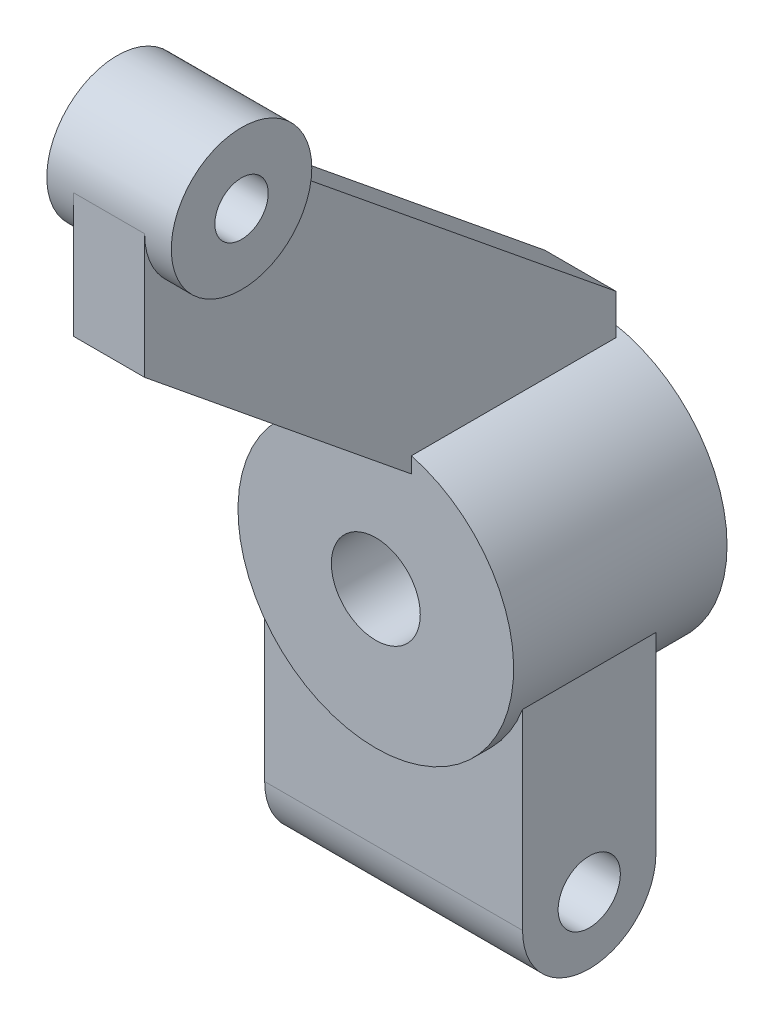
from build123d import *
from build123d.topology import SkipClean

# Parameters (mm, degrees)
SKETCH1_R            = 7.75
MAIN_CYLINDER_DEPTH  = 12
DROP_DEPTH           = 7.25
RISER_DEPTH          = 2
SKETCH5_R            = 3.95
RISER_BOSS_DEPTH     = 3.5
TOP_HOLES_DEPTH      = 42.720798171
TOP_HOLES_DEPTH_BACK = 42.720798171
SKETCH6_R            = 1.5
SKETCH7_R            = 1.75
BOTTOM_HOLES_DEPTH   = 43.884291996
SKETCH8_R            = 2.5
BEARING_HOLE_DEPTH   = 41.916072637


with BuildPart() as part:
    # Sketch1 → Main Cylinder (new body)
    with BuildSketch(Plane.XY):
        Circle(SKETCH1_R)
    extrude(amount=MAIN_CYLINDER_DEPTH)

    # Sketch2 → Drop (add, symmetric)
    with BuildSketch(Plane(origin=(0, 0, 0), x_dir=(0, 0, -1), z_dir=(1, 0, 0))):
        with BuildLine():
            Line((-3.5, -2.013895629), (-3.5, -13.5))
            ThreePointArc((-3.5, -13.5), (-7.25, -17.25), (-11, -13.5))
            Line((-11, -13.5), (-11, -2.013895629))
            Line((-11, -2.013895629), (-3.5, -2.013895629))
        make_face()
    extrude(amount=DROP_DEPTH, both=True)

    # Sketch3 → Riser (add, symmetric)
    with BuildSketch(Plane(origin=(0, 0, 0), x_dir=(0, 0, -1), z_dir=(1, 0, 0))):
        with BuildLine():
            Line((-27, 18.805363243), (-27, 25.8))
            ThreePointArc((-27, 25.8), (-22.625995284, 29.727177103), (-19.191027848, 24.956890322))
            Line((-19.191027848, 24.956890322), (-0.5, 9.75))
            Line((-0.5, 9.75), (-0.5, 5.606009061))
            Line((-0.5, 5.606009061), (-12, 5.606009061))
            Line((-12, 5.606009061), (-12, 6.601467519))
            Line((-12, 6.601467519), (-27, 18.805363243))
        make_face()
    extrude(amount=RISER_DEPTH, both=True)

    # Sketch5 → Riser Boss (add, symmetric)
    with SkipClean():  # the faces are left unmerged after this step: merging them gives an invalid solid
        with BuildSketch(Plane(origin=(0, 0, 0), x_dir=(0, 0, -1), z_dir=(1, 0, 0))):
            with Locations((-23.05, 25.8)):
                Circle(SKETCH5_R)
        extrude(amount=RISER_BOSS_DEPTH, both=True)

    # Sketch6 → Top Holes (cut, two sides: drawn at the far end of the back side and taken through both)
    with SkipClean():  # the faces are left unmerged after this step: merging them gives an invalid solid
        with BuildSketch(Plane(origin=(3.5, 0, 0), x_dir=(0, 0, -1), z_dir=(1, 0, 0)).offset(-TOP_HOLES_DEPTH_BACK)):
            with Locations((-23.05, 25.8)):
                Circle(SKETCH6_R)
        extrude(amount=TOP_HOLES_DEPTH + TOP_HOLES_DEPTH_BACK, mode=Mode.SUBTRACT)

    # Sketch7 → Bottom Holes (cut, through all)
    with SkipClean():  # the faces are left unmerged after this step: merging them gives an invalid solid
        with BuildSketch(Plane(origin=(7.25, 0, 0), x_dir=(0, 0, -1), z_dir=(1, 0, 0))):
            with Locations((-7.25, -13.5)):
                Circle(SKETCH7_R)
        extrude(amount=-BOTTOM_HOLES_DEPTH, mode=Mode.SUBTRACT)

    # Sketch8 → Bearing Hole (cut, through all)
    with SkipClean():  # the faces are left unmerged after this step: merging them gives an invalid solid
        with BuildSketch(Plane(origin=(0, 0, 0), x_dir=(-1, 0, 0), z_dir=(0, 0, -1))):
            Circle(SKETCH8_R)
        extrude(amount=-BEARING_HOLE_DEPTH, mode=Mode.SUBTRACT)


solid = part.part
